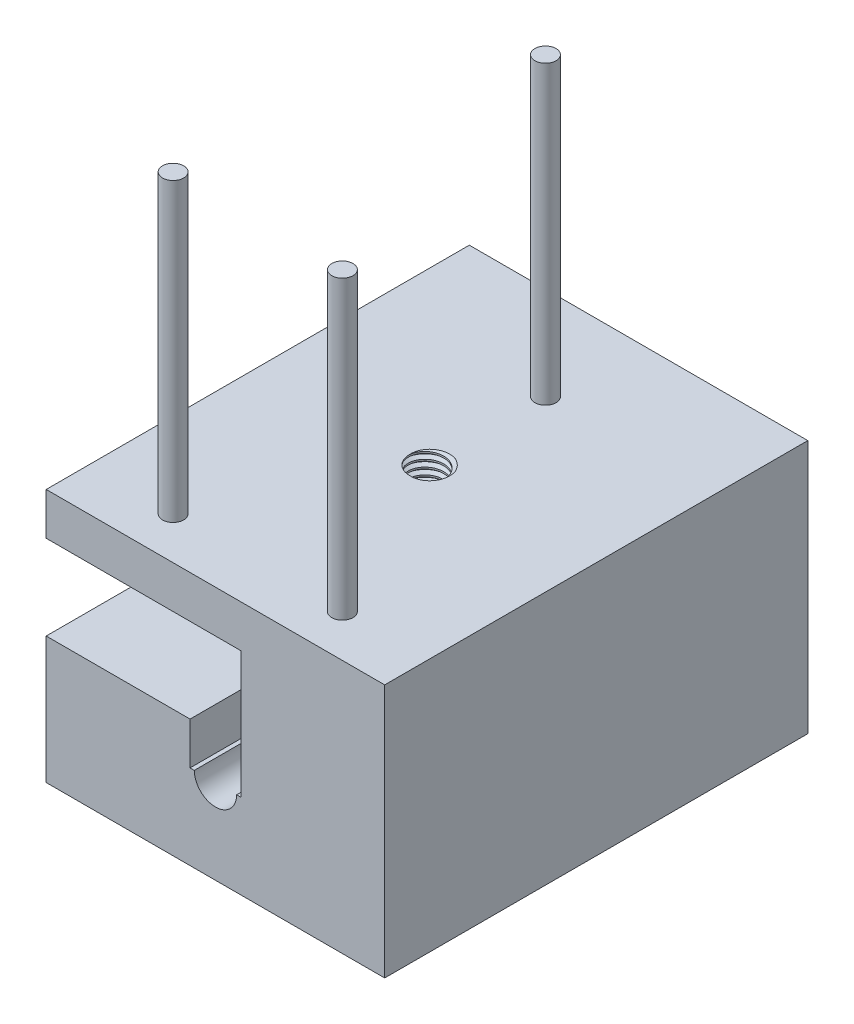
from build123d import *

# Parameters (mm, degrees)
BOSS_EXTRUDE1_DEPTH              = 50
TAP_DRILL_FOR_M5X0_8_TAP1_REACH  = 72.711
TAP_DRILL_FOR_M5X0_8_TAP1_BORE_R = 2.1
THREAD1_PITCH                    = 0.8
SKETCH7_R                        = 1.25
BOSS_EXTRUDE2_DEPTH              = 35
SKETCH8_R                        = 1.25
BOSS_EXTRUDE3_DEPTH              = 35


with BuildPart() as part:
    # Sketch1 → Boss-Extrude1 (new body)
    with BuildSketch(Plane.XY):
        with BuildLine():
            Line((0, 0), (0, 30))
            Line((0, 30), (-40, 30))
            Line((-40, 30), (-40, 25))
            Line((-40, 25), (-17, 25))
            Line((-17, 25), (-17, 10))
            Line((-17, 10), (-17.5, 10))
            ThreePointArc((-17.5, 10), (-20, 7.5), (-22.5, 10))
            Line((-22.5, 10), (-23, 10))
            Line((-23, 10), (-23, 15))
            Line((-23, 15), (-40, 15))
            Line((-40, 15), (-40, 0))
            Line((-40, 0), (0, 0))
        make_face()
    extrude(amount=BOSS_EXTRUDE1_DEPTH)

    # Tap Drill for M5x0.8 Tap1 bore → Tap Drill for M5x0.8 Tap1 (cut, up to next)
    with BuildSketch(Plane(origin=(0, 30, 0), x_dir=(1, 0, 0), z_dir=(0, 1, 0)), mode=Mode.PRIVATE) as tap_drill_for_m5x0_8_tap1_sk1:
        with Locations((-20, -25)):
            Circle(TAP_DRILL_FOR_M5X0_8_TAP1_BORE_R)
    tap_drill_for_m5x0_8_tap1_tool1 = extrude(tap_drill_for_m5x0_8_tap1_sk1.sketch, amount=-TAP_DRILL_FOR_M5X0_8_TAP1_REACH, mode=Mode.PRIVATE) & part.part
    add(tap_drill_for_m5x0_8_tap1_tool1.solids().sort_by_distance((-20, 30, 25))[0], mode=Mode.SUBTRACT)

    # Thread1: the profile of Thread Profile1 profile screwed along a right-hand helix of 12.5 turns, 8 arcs to a turn; built about Z, then put on its axis
    thread1_z = Axis((0, 0, 0), (0, 0, 1))
    thread1_corners = [(2.0997, 0, -0.000173205), (2.5330127, 0, 0.249999999), (2.5330127, 0, 0.349999999), (2.0997, 0, 0.600173203)]
    with BuildLine(mode=Mode.PRIVATE) as thread1_profile:
        Line(thread1_corners[0], thread1_corners[1])
        Line(thread1_corners[1], thread1_corners[2])
        Line(thread1_corners[2], thread1_corners[3])
        Line(thread1_corners[3], thread1_corners[0])
    thread1_cap = Face(thread1_profile.wire())
    thread1_turn_angles = [0, 22.5, 45, 67.5, 90, 112.5, 135, 157.5, 180, 202.5, 225, 247.5, 270, 292.5, 315, 337.5, 360]
    thread1_turn_weights = [1, 0.9238795325112867, 1, 0.9238795325112867, 1, 0.9238795325112867, 1, 0.9238795325112867, 1, 0.9238795325112867, 1, 0.9238795325112867, 1, 0.9238795325112867, 1, 0.9238795325112867, 1]
    thread1_turn_rails = [Edge.make_bspline([Vector(p[0], p[1], 0).rotate(thread1_z, thread1_turn_angles[k]) / thread1_turn_weights[k] + Vector(0, 0, p[2] + THREAD1_PITCH * thread1_turn_angles[k] / 360) for k in range(17)], [0, 0, 0, 1, 1, 2, 2, 3, 3, 4, 4, 5, 5, 6, 6, 7, 7, 8, 8, 8], 2, thread1_turn_weights) for p in thread1_corners]
    thread1_turn_sides = [Face.make_surface_from_curves(thread1_turn_rails[p[0]], thread1_turn_rails[p[1]]) for p in [(0, 1), (1, 2), (2, 3), (3, 0)]]
    thread1_last_angles = [4320, 4342.5, 4365, 4387.5, 4410, 4432.5, 4455, 4477.5, 4500]
    thread1_last_weights = [1, 0.9238795325112867, 1, 0.9238795325112867, 1, 0.9238795325112867, 1, 0.9238795325112867, 1]
    thread1_last_rails = [Edge.make_bspline([Vector(p[0], p[1], 0).rotate(thread1_z, thread1_last_angles[k]) / thread1_last_weights[k] + Vector(0, 0, p[2] + THREAD1_PITCH * thread1_last_angles[k] / 360) for k in range(9)], [0, 0, 0, 1, 1, 2, 2, 3, 3, 4, 4, 4], 2, thread1_last_weights) for p in thread1_corners]
    thread1_last_sides = [Face.make_surface_from_curves(thread1_last_rails[p[0]], thread1_last_rails[p[1]]) for p in [(0, 1), (1, 2), (2, 3), (3, 0)]]
    thread1 = Plane(origin=(-20, 33, 25), x_dir=(-1, 0, 0), z_dir=(0, -1, 0)) * Solid(Shell([*[p.moved(Location((0, 0, THREAD1_PITCH * i))) for i in range(12) for p in thread1_turn_sides], *thread1_last_sides, thread1_cap, thread1_cap.rotate(thread1_z, 4500).moved(Location((0, 0, THREAD1_PITCH * 4500 / 360)))]))
    add(thread1, mode=Mode.SUBTRACT)

    # Sketch7 → Boss-Extrude2 (add)
    with BuildSketch(Plane(origin=(0, 30, 0), x_dir=(1, 0, 0), z_dir=(0, 1, 0))):
        with Locations((-20, -11)):
            Circle(SKETCH7_R)
    extrude(amount=BOSS_EXTRUDE2_DEPTH)

    # Sketch8 → Boss-Extrude3 (add)
    with BuildSketch(Plane(origin=(0, 30, 0), x_dir=(1, 0, 0), z_dir=(0, 1, 0))):
        with Locations((-30, -45)):
            Circle(SKETCH8_R)
        with Locations((-10, -45)):
            Circle(SKETCH8_R)
    extrude(amount=BOSS_EXTRUDE3_DEPTH)


solid = part.part
